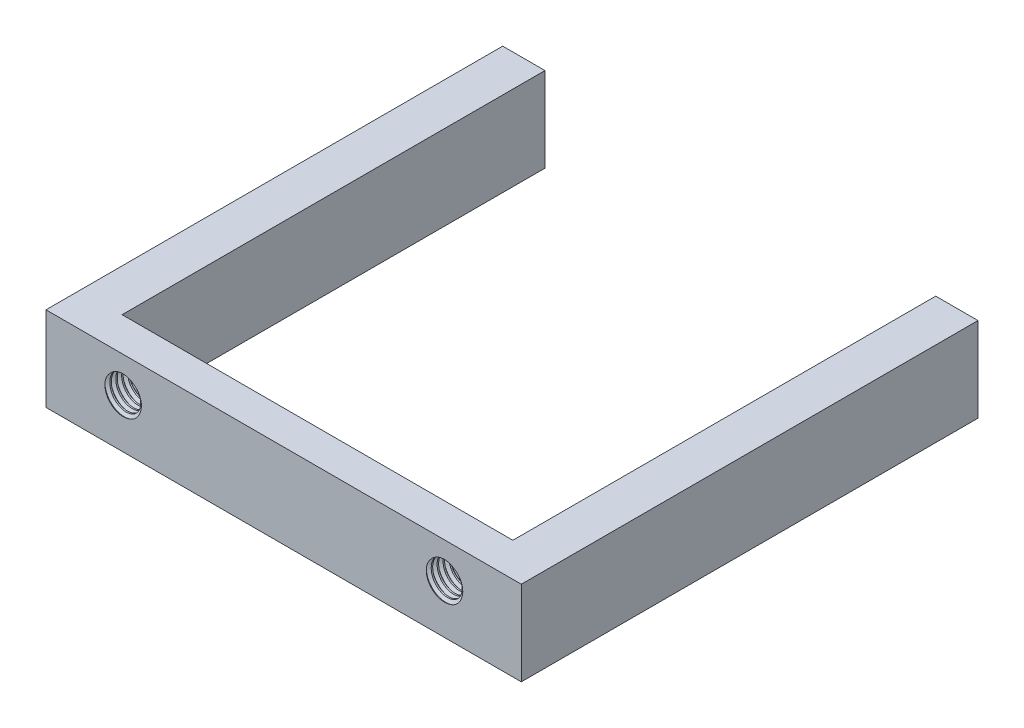
from build123d import *

# Parameters (mm, degrees)
SKETCH1_W           = 56.2
SKETCH1_H           = 10
SKETCH1_R           = 2
BOSS_EXTRUDE1_DEPTH = 4
SKETCH2_W           = 16.6
SKETCH2_H           = 2
BOSS_EXTRUDE2_DEPTH = 2.9
THREAD1_PITCH       = 0.7
THREAD2_PITCH       = 0.7
SKETCH3_W           = 5
SKETCH3_H           = 10
BOSS_EXTRUDE3_DEPTH = 50


with BuildPart() as part:
    # Sketch1 → Boss-Extrude1 (new body)
    with BuildSketch(Plane.XY):
        with Locations((28.1, 5)):
            Rectangle(SKETCH1_W, SKETCH1_H)
        with Locations((9.1, 6)):
            Circle(SKETCH1_R, mode=Mode.SUBTRACT)
        with Locations((47.1, 6)):
            Circle(SKETCH1_R, mode=Mode.SUBTRACT)
    extrude(amount=BOSS_EXTRUDE1_DEPTH)

    # Sketch2 → Boss-Extrude2 (add)
    with BuildSketch(Plane.XZ):
        with Locations((8.3, -1)):
            Rectangle(SKETCH2_W, SKETCH2_H)
        with Locations((47.9, -1)):
            Rectangle(SKETCH2_W, SKETCH2_H)
    extrude(amount=-BOSS_EXTRUDE2_DEPTH)

    # Thread1: the profile of Thread Profile1 profile screwed along a right-hand helix of 7.142857 turns, 6 arcs to a turn; built about Z, then put on its axis
    thread1_z = Axis((0, 0, 0), (0, 0, 1))
    thread1_corners = [(1.9997, 0, -0.000173205), (2.378886112, 0, 0.218749999), (2.378886112, 0, 0.306249999), (1.9997, 0, 0.525173203)]
    with BuildLine(mode=Mode.PRIVATE) as thread1_profile:
        Line(thread1_corners[0], thread1_corners[1])
        Line(thread1_corners[1], thread1_corners[2])
        Line(thread1_corners[2], thread1_corners[3])
        Line(thread1_corners[3], thread1_corners[0])
    thread1_cap = Face(thread1_profile.wire())
    thread1_turn_angles = [0, 30, 60, 90, 120, 150, 180, 210, 240, 270, 300, 330, 360]
    thread1_turn_weights = [1, 0.8660254037844387, 1, 0.8660254037844387, 1, 0.8660254037844387, 1, 0.8660254037844387, 1, 0.8660254037844387, 1, 0.8660254037844387, 1]
    thread1_turn_rails = [Edge.make_bspline([Vector(p[0], p[1], 0).rotate(thread1_z, thread1_turn_angles[k]) / thread1_turn_weights[k] + Vector(0, 0, p[2] + THREAD1_PITCH * thread1_turn_angles[k] / 360) for k in range(13)], [0, 0, 0, 1, 1, 2, 2, 3, 3, 4, 4, 5, 5, 6, 6, 6], 2, thread1_turn_weights) for p in thread1_corners]
    thread1_turn_sides = [Face.make_surface_from_curves(thread1_turn_rails[p[0]], thread1_turn_rails[p[1]]) for p in [(0, 1), (1, 2), (2, 3), (3, 0)]]
    thread1_last_angles = [2520, 2545.714285714, 2571.428571429]
    thread1_last_weights = [1, 0.9009688679024186, 1]
    thread1_last_rails = [Edge.make_bspline([Vector(p[0], p[1], 0).rotate(thread1_z, thread1_last_angles[k]) / thread1_last_weights[k] + Vector(0, 0, p[2] + THREAD1_PITCH * thread1_last_angles[k] / 360) for k in range(3)], [0, 0, 0, 1, 1, 1], 2, thread1_last_weights) for p in thread1_corners]
    thread1_last_sides = [Face.make_surface_from_curves(thread1_last_rails[p[0]], thread1_last_rails[p[1]]) for p in [(0, 1), (1, 2), (2, 3), (3, 0)]]
    thread1 = Plane(origin=(47.1, 6, -1), x_dir=(1, 0, 0), z_dir=(0, 0, 1)) * Solid(Shell([*[p.moved(Location((0, 0, THREAD1_PITCH * i))) for i in range(7) for p in thread1_turn_sides], *thread1_last_sides, thread1_cap, thread1_cap.rotate(thread1_z, 2571.428571429).moved(Location((0, 0, THREAD1_PITCH * 2571.428571429 / 360)))]))
    add(thread1, mode=Mode.SUBTRACT)

    # Thread2: the profile of Thread Profile2 profile screwed along a right-hand helix of 7.142857 turns, 6 arcs to a turn; built about Z, then put on its axis
    thread2_z = Axis((0, 0, 0), (0, 0, 1))
    thread2_corners = [(1.9997, 0, -0.000173205), (2.378886113, 0, 0.218749999), (2.378886113, 0, 0.306249999), (1.9997, 0, 0.525173203)]
    with BuildLine(mode=Mode.PRIVATE) as thread2_profile:
        Line(thread2_corners[0], thread2_corners[1])
        Line(thread2_corners[1], thread2_corners[2])
        Line(thread2_corners[2], thread2_corners[3])
        Line(thread2_corners[3], thread2_corners[0])
    thread2_cap = Face(thread2_profile.wire())
    thread2_turn_angles = [0, 30, 60, 90, 120, 150, 180, 210, 240, 270, 300, 330, 360]
    thread2_turn_weights = [1, 0.8660254037844387, 1, 0.8660254037844387, 1, 0.8660254037844387, 1, 0.8660254037844387, 1, 0.8660254037844387, 1, 0.8660254037844387, 1]
    thread2_turn_rails = [Edge.make_bspline([Vector(p[0], p[1], 0).rotate(thread2_z, thread2_turn_angles[k]) / thread2_turn_weights[k] + Vector(0, 0, p[2] + THREAD2_PITCH * thread2_turn_angles[k] / 360) for k in range(13)], [0, 0, 0, 1, 1, 2, 2, 3, 3, 4, 4, 5, 5, 6, 6, 6], 2, thread2_turn_weights) for p in thread2_corners]
    thread2_turn_sides = [Face.make_surface_from_curves(thread2_turn_rails[p[0]], thread2_turn_rails[p[1]]) for p in [(0, 1), (1, 2), (2, 3), (3, 0)]]
    thread2_last_angles = [2520, 2545.714285714, 2571.428571429]
    thread2_last_weights = [1, 0.9009688679024186, 1]
    thread2_last_rails = [Edge.make_bspline([Vector(p[0], p[1], 0).rotate(thread2_z, thread2_last_angles[k]) / thread2_last_weights[k] + Vector(0, 0, p[2] + THREAD2_PITCH * thread2_last_angles[k] / 360) for k in range(3)], [0, 0, 0, 1, 1, 1], 2, thread2_last_weights) for p in thread2_corners]
    thread2_last_sides = [Face.make_surface_from_curves(thread2_last_rails[p[0]], thread2_last_rails[p[1]]) for p in [(0, 1), (1, 2), (2, 3), (3, 0)]]
    thread2 = Plane(origin=(9.1, 6, -1), x_dir=(1, 0, 0), z_dir=(0, 0, 1)) * Solid(Shell([*[p.moved(Location((0, 0, THREAD2_PITCH * i))) for i in range(7) for p in thread2_turn_sides], *thread2_last_sides, thread2_cap, thread2_cap.rotate(thread2_z, 2571.428571429).moved(Location((0, 0, THREAD2_PITCH * 2571.428571429 / 360)))]))
    add(thread2, mode=Mode.SUBTRACT)

    # Sketch3 → Boss-Extrude3 (add)
    with BuildSketch(Plane(origin=(0, 0, 0), x_dir=(-1, 0, 0), z_dir=(0, 0, -1))):
        with Locations((-53.7, 5)):
            Rectangle(SKETCH3_W, SKETCH3_H)
        with Locations((-2.5, 5)):
            Rectangle(SKETCH3_W, SKETCH3_H)
    extrude(amount=BOSS_EXTRUDE3_DEPTH)


solid = part.part
